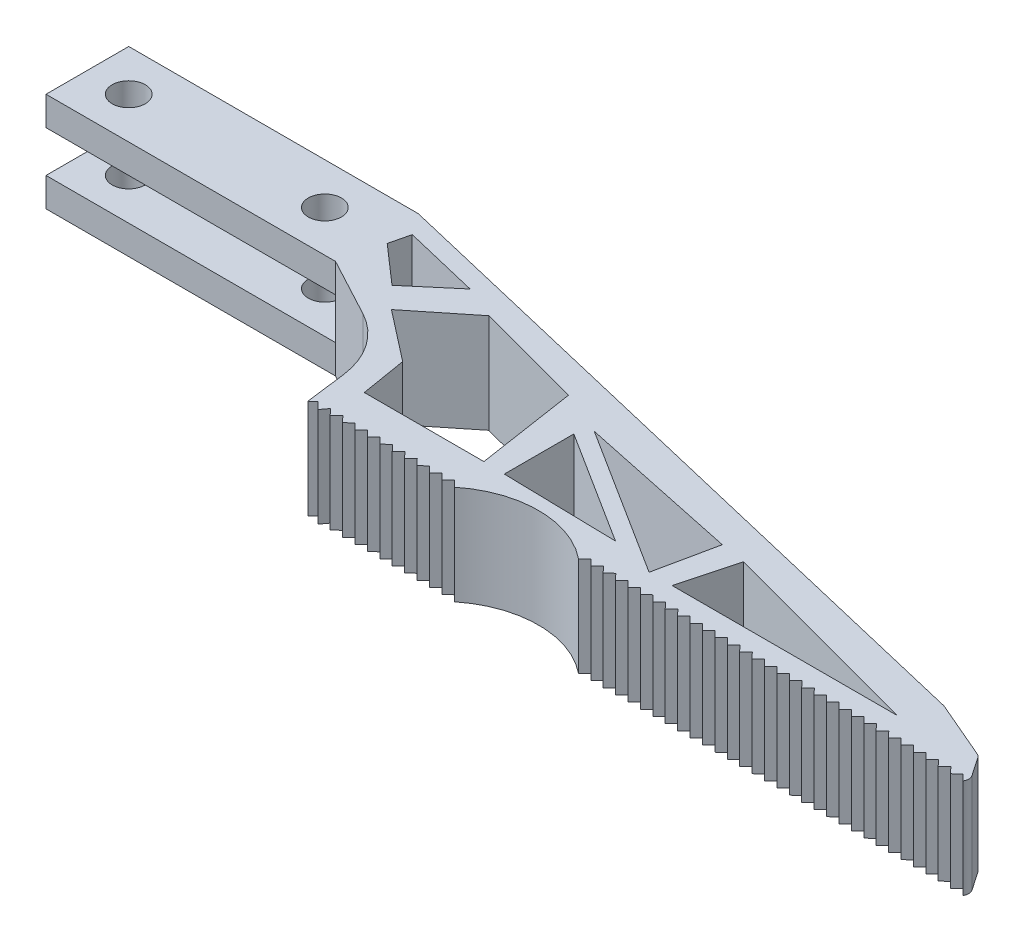
from build123d import *

# Parameters (mm, degrees)
SKETCH1_R           = 2
BOSS_EXTRUDE1_DEPTH = 12
SKETCH4_W           = 35
SKETCH4_H           = 5
CUT_EXTRUDE1_DEPTH  = 113.433125829
FILLET2_R           = 10
FILLET3_R           = 1
CUT_EXTRUDE2_DEPTH  = 12


with BuildPart() as part:
    # Sketch1 → Boss-Extrude1 (new body)
    with BuildSketch(Plane(origin=(0, 0, 0), x_dir=(1, 0, 0), z_dir=(0, 1, 0))):
        with BuildLine():
            Line((100.816274371, -14.757411095), (17.5, 5))
            Line((17.5, 5), (-17.5, 5))
            Line((-17.5, 5), (-17.5, -5))
            Line((-17.5, -5), (17.5, -5))
            Line((17.5, -5), (29.181673037, -11.258392105))
            Line((29.181673037, -11.258392105), (30.466555694, -21.314125588))
            Line((30.466555694, -21.314125588), (31.091317661, -20.709888136))
            Line((31.091317661, -20.709888136), (31.94121893, -21.588658537))
            Line((31.94121893, -21.588658537), (32.591317661, -20.709888136))
            Line((32.591317661, -20.709888136), (33.316274371, -21.459469908))
            Line((33.316274371, -21.459469908), (34.091317661, -20.709888136))
            Line((34.091317661, -20.709888136), (34.816274371, -21.459469908))
            Line((34.816274371, -21.459469908), (35.591317661, -20.709888136))
            Line((35.591317661, -20.709888136), (36.316274371, -21.459469908))
            Line((36.316274371, -21.459469908), (37.091317661, -20.709888136))
            Line((37.091317661, -20.709888136), (37.816274371, -21.459469908))
            Line((37.816274371, -21.459469908), (38.591317661, -20.709888136))
            Line((38.591317661, -20.709888136), (39.316274371, -21.459469908))
            Line((39.316274371, -21.459469908), (40.091317661, -20.709888136))
            Line((40.091317661, -20.709888136), (40.816274371, -21.459469908))
            Line((40.816274371, -21.459469908), (41.591317661, -20.709888136))
            Line((41.591317661, -20.709888136), (42.316274371, -21.459469908))
            Line((42.316274371, -21.459469908), (43.091317661, -20.709888136))
            Line((43.091317661, -20.709888136), (43.816274371, -21.459469908))
            Line((43.816274371, -21.459469908), (44.591317661, -20.709888136))
            Line((44.591317661, -20.709888136), (45.316274371, -21.459469908))
            Line((45.316274371, -21.459469908), (46.091317661, -20.709888136))
            Line((46.091317661, -20.709888136), (46.816274371, -21.459469908))
            Line((46.816274371, -21.459469908), (47.591317661, -20.709888136))
            Line((47.591317661, -20.709888136), (48.316274371, -21.459469908))
            ThreePointArc((48.316274371, -21.459469908), (55.82900513, -18.797151194), (63.341735888, -21.459469908))
            Line((63.341735888, -21.459469908), (64.091317661, -20.709888136))
            Line((64.091317661, -20.709888136), (64.816274371, -21.459469908))
            Line((64.816274371, -21.459469908), (65.591317661, -20.709888136))
            Line((65.591317661, -20.709888136), (66.316274371, -21.459469908))
            Line((66.316274371, -21.459469908), (67.091317661, -20.709888136))
            Line((67.091317661, -20.709888136), (67.816274371, -21.459469908))
            Line((67.816274371, -21.459469908), (68.591317661, -20.709888136))
            Line((68.591317661, -20.709888136), (69.316274371, -21.459469908))
            Line((69.316274371, -21.459469908), (70.091317661, -20.709888136))
            Line((70.091317661, -20.709888136), (70.816274371, -21.459469908))
            Line((70.816274371, -21.459469908), (71.591317661, -20.709888136))
            Line((71.591317661, -20.709888136), (72.316274371, -21.459469908))
            Line((72.316274371, -21.459469908), (73.091317661, -20.709888136))
            Line((73.091317661, -20.709888136), (73.816274371, -21.459469908))
            Line((73.816274371, -21.459469908), (74.591317661, -20.709888136))
            Line((74.591317661, -20.709888136), (75.316274371, -21.459469908))
            Line((75.316274371, -21.459469908), (76.091317661, -20.709888136))
            Line((76.091317661, -20.709888136), (76.816274371, -21.459469908))
            Line((76.816274371, -21.459469908), (77.591317661, -20.709888136))
            Line((77.591317661, -20.709888136), (78.316274371, -21.459469908))
            Line((78.316274371, -21.459469908), (79.091317661, -20.709888136))
            Line((79.091317661, -20.709888136), (79.816274371, -21.459469908))
            Line((79.816274371, -21.459469908), (80.591317661, -20.709888136))
            Line((80.591317661, -20.709888136), (81.316274371, -21.459469908))
            Line((81.316274371, -21.459469908), (82.091317661, -20.709888136))
            Line((82.091317661, -20.709888136), (82.816274371, -21.459469908))
            Line((82.816274371, -21.459469908), (83.591317661, -20.709888136))
            Line((83.591317661, -20.709888136), (84.316274371, -21.459469908))
            Line((84.316274371, -21.459469908), (85.091317661, -20.709888136))
            Line((85.091317661, -20.709888136), (85.816274371, -21.459469908))
            Line((85.816274371, -21.459469908), (86.591317661, -20.709888136))
            Line((86.591317661, -20.709888136), (87.316274371, -21.459469908))
            Line((87.316274371, -21.459469908), (88.091317661, -20.709888136))
            Line((88.091317661, -20.709888136), (88.816274371, -21.459469908))
            Line((88.816274371, -21.459469908), (89.591317661, -20.709888136))
            Line((89.591317661, -20.709888136), (90.316274371, -21.459469908))
            Line((90.316274371, -21.459469908), (91.091317661, -20.709888136))
            Line((91.091317661, -20.709888136), (91.816274371, -21.459469908))
            Line((91.816274371, -21.459469908), (92.591317661, -20.709888136))
            Line((92.591317661, -20.709888136), (93.316274371, -21.459469908))
            Line((93.316274371, -21.459469908), (94.091317661, -20.709888136))
            Line((94.091317661, -20.709888136), (94.816274371, -21.459469908))
            Line((94.816274371, -21.459469908), (95.591317661, -20.709888136))
            Line((95.591317661, -20.709888136), (96.316274371, -21.459469908))
            Line((96.316274371, -21.459469908), (97.091317661, -20.709888136))
            Line((97.091317661, -20.709888136), (97.816274371, -21.459469908))
            Line((97.816274371, -21.459469908), (98.591317661, -20.709888136))
            Line((98.591317661, -20.709888136), (99.316274371, -21.459469908))
            Line((99.316274371, -21.459469908), (100.091317661, -20.709888136))
            Line((100.091317661, -20.709888136), (100.816274371, -21.459469908))
            Line((100.816274371, -21.459469908), (101.591317661, -20.709888136))
            Line((101.591317661, -20.709888136), (102.316274371, -21.459469908))
            Line((102.316274371, -21.459469908), (103.091317661, -20.709888136))
            Line((103.091317661, -20.709888136), (103.816274371, -21.459469908))
            Line((103.816274371, -21.459469908), (104.591317661, -20.709888136))
            Line((104.591317661, -20.709888136), (105.316274371, -21.459469908))
            Line((105.316274371, -21.459469908), (106.091317661, -20.709888136))
            Line((106.091317661, -20.709888136), (106.816274371, -21.459469908))
            Line((106.816274371, -21.459469908), (107.591317661, -20.709888136))
            Line((107.591317661, -20.709888136), (108.316274371, -21.459469908))
            Line((108.316274371, -21.459469908), (109.091317661, -20.709888136))
            Line((109.091317661, -20.709888136), (109.816274371, -21.459469908))
            Line((109.816274371, -21.459469908), (110.553264048, -21.459469908))
            Line((110.553264048, -21.459469908), (108.108025111, -17.888455122))
            Line((108.108025111, -17.888455122), (100.816274371, -14.757411095))
        make_face()
        with Locations(Location((11.21, 0, 0), (0, 0, 270))):
            Circle(SKETCH1_R, mode=Mode.SUBTRACT)
        with Locations(Location((-12.5, 0, 0), (0, 0, 270))):
            Circle(SKETCH1_R, mode=Mode.SUBTRACT)
    extrude(amount=BOSS_EXTRUDE1_DEPTH)

    # Sketch4 → Cut-Extrude1 (cut, through all)
    with BuildSketch(Plane.XY.offset(5)):
        with Locations((0, 6)):
            Rectangle(SKETCH4_W, SKETCH4_H)
    extrude(amount=-CUT_EXTRUDE1_DEPTH, mode=Mode.SUBTRACT)

    # Fillet2
    fillet2_edges = [part.edges().sort_by_distance(p)[0] for p in [
        (29.181673037, 6, 11.258392105),
    ]]
    fillet(fillet2_edges, radius=FILLET2_R)

    # Fillet3
    # the kernel refuses this fillet: 1 mm, written as the material it takes off along each edge
    with BuildSketch(Plane(origin=(100.816274371, -0.216477457, 14.757411095), x_dir=(-0.9730157961539994, 0, -0.23073851094864703), z_dir=(0, 1, 0))) as fillet3_piece_1:
        with BuildLine():
            CenterArc((FILLET3_R * 0.0865909827585, FILLET3_R), FILLET3_R, 260.102093181, 9.897906819)
            Line((-FILLET3_R * 0.0853021285033, FILLET3_R * 0.0148843934336), (-FILLET3_R * 0.0887399907286, -FILLET3_R * 0.00481791869774))
            Line((-FILLET3_R * 0.0887399907286, -FILLET3_R * 0.00481791869774), (-FILLET3_R * 0.00173181965517, -FILLET3_R * 0.02))
            Line((-FILLET3_R * 0.00173181965517, -FILLET3_R * 0.02), (FILLET3_R * 0.0865909827585, -FILLET3_R * 0.02))
            Line((FILLET3_R * 0.0865909827585, -FILLET3_R * 0.02), (FILLET3_R * 0.0865909827585, 0))
        make_face()
    extrude(amount=12.432954914, mode=Mode.SUBTRACT)
    with BuildSketch(Plane(origin=(108.108025111, -0.725377826, 17.888455122), x_dir=(-0.9188706856920634, 0, -0.3945588206792459), z_dir=(0, 1, 0))) as fillet3_piece_2:
        with BuildLine():
            CenterArc((FILLET3_R * 0.29015113035, FILLET3_R), FILLET3_R, 237.639707831, 32.360292169)
            Line((-FILLET3_R * 0.245090389396, FILLET3_R * 0.155300931965), (-FILLET3_R * 0.255795219791, FILLET3_R * 0.138406950604))
            Line((-FILLET3_R * 0.255795219791, FILLET3_R * 0.138406950604), (-FILLET3_R * 0.005803022607, -FILLET3_R * 0.02))
            Line((-FILLET3_R * 0.005803022607, -FILLET3_R * 0.02), (FILLET3_R * 0.29015113035, -FILLET3_R * 0.02))
            Line((FILLET3_R * 0.29015113035, -FILLET3_R * 0.02), (FILLET3_R * 0.29015113035, 0))
        make_face()
    extrude(amount=13.450755652, mode=Mode.SUBTRACT)
    with BuildSketch(Plane(origin=(110.553264048, -3.340980233, 21.459469908), x_dir=(-0.56498494903948, 0, -0.8251012103729192), z_dir=(0, 1, 0))) as fillet3_piece_3:
        with BuildLine():
            CenterArc((1.336392093, 1), FILLET3_R, 203.073330595, 66.926669405)
            Line((0.416388075, 0.608091074), (0.397987995, 0.600252896))
            ThreePointArc((0.397987995, 0.600252896), (0.191692013, 0.315345236), (-0.016502024, 0.011299699))
            Line((-0.016502024, 0.011299699), (0, -0.02))
            Line((0, -0.02), (1.336392093, -0.02))
            Line((1.336392093, -0.02), (1.336392093, 0))
        make_face()
    extrude(amount=18.681960466, mode=Mode.SUBTRACT)

    # Sketch5 → Cut-Extrude2 (cut)
    with BuildSketch(Plane(origin=(0, 12, 0), x_dir=(1, 0, 0), z_dir=(0, 1, 0))):
        Polygon((19.332052257, 2.4424245), (28.526818603, 0.242248117), (23.41536762, -4.087850301), (18.747614926, 0), align=None)
        Polygon((25.921082251, -6.661828657), (32.046043612, -11.428585655), (32.967525074, -16.9883699), (47.424517669, -16.9883699), (45.590433757, -4.934746753), (32.454936428, -1.421521761), align=None)
        Polygon((50.93529797, -7.151679552), (70.537795207, -11.282164386), (68.99785337, -18.590436131), align=None)
        Polygon((49.967342783, -8.662131451), (63.701149707, -17.359553871), (49.967342783, -17.061744713), align=None)
        Polygon((71.772087814, -18.590436131), (98.977842755, -18.590436131), (73.60079207, -11.778158935), align=None)
    extrude(amount=-CUT_EXTRUDE2_DEPTH, mode=Mode.SUBTRACT)


solid = part.part
